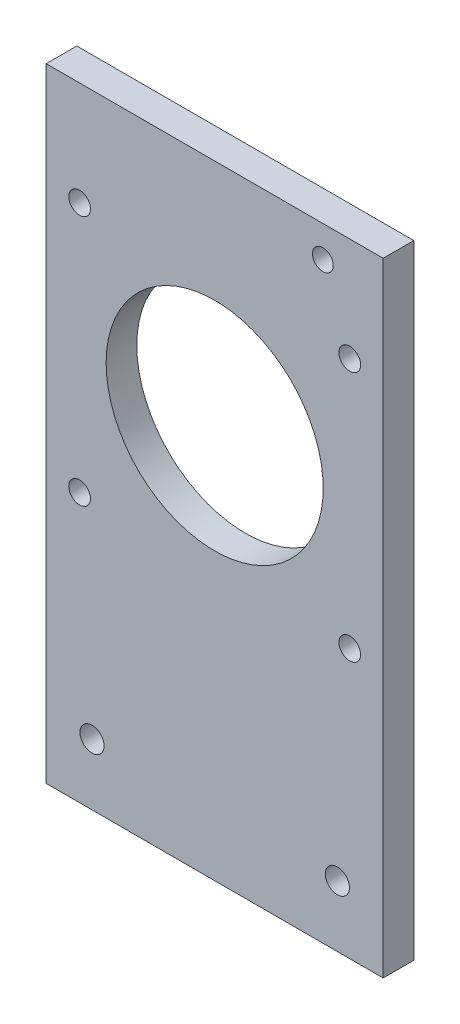
from build123d import *

# Parameters (mm, degrees)
SKETCH2_R               = 22.5
BOSS_EXTRUDE1_DEPTH     = 3.175
CUT_EXTRUDE1_DEPTH      = 134.987753638
CUT_EXTRUDE1_DEPTH_BACK = 134.987753638
SKETCH3_R               = 2.5
SKETCH3_R_2             = 2.15
CUT_EXTRUDE2_DEPTH      = 134.987753638
CUT_EXTRUDE2_DEPTH_BACK = 134.987753638
SKETCH4_R               = 2.25


with BuildPart() as part:
    # Sketch2 → Boss-Extrude1 (new, symmetric)
    with BuildSketch(Plane.XY):
        Polygon((-34.925, 0), (34.925, 0), (34.925, 81.7), (34.925, 114.2), (34.925, 129.2), (-34.925, 129.2), (-34.925, 114.2), (-34.925, 81.7), align=None)
        with Locations((0, 81.7)):
            Circle(SKETCH2_R, mode=Mode.SUBTRACT)
    extrude(amount=BOSS_EXTRUDE1_DEPTH, both=True)

    # Sketch3 → Cut-Extrude1 (cut, two sides: drawn at the far end of the back side and taken through both)
    with BuildSketch(Plane.XY.offset(3.175).offset(-CUT_EXTRUDE1_DEPTH_BACK)):
        with Locations((-25.425, 12.7)):
            Circle(SKETCH3_R)
        with Locations((25.425, 12.7)):
            Circle(SKETCH3_R)
        with Locations((22.425, 122.7)):
            Circle(SKETCH3_R_2)
    extrude(amount=CUT_EXTRUDE1_DEPTH + CUT_EXTRUDE1_DEPTH_BACK, mode=Mode.SUBTRACT)

    # Sketch4 → Cut-Extrude2 (cut, two sides: drawn at the far end of the back side and taken through both)
    with BuildSketch(Plane(origin=(0, 0, -3.175), x_dir=(-1, 0, 0), z_dir=(0, 0, -1)).offset(-CUT_EXTRUDE2_DEPTH_BACK)):
        with Locations((-28, 107.7)):
            Circle(SKETCH4_R)
        with Locations((28, 107.7)):
            Circle(SKETCH4_R)
        with Locations((-28, 55.7)):
            Circle(SKETCH4_R)
        with Locations((28, 55.7)):
            Circle(SKETCH4_R)
    extrude(amount=CUT_EXTRUDE2_DEPTH + CUT_EXTRUDE2_DEPTH_BACK, mode=Mode.SUBTRACT)


solid = part.part
